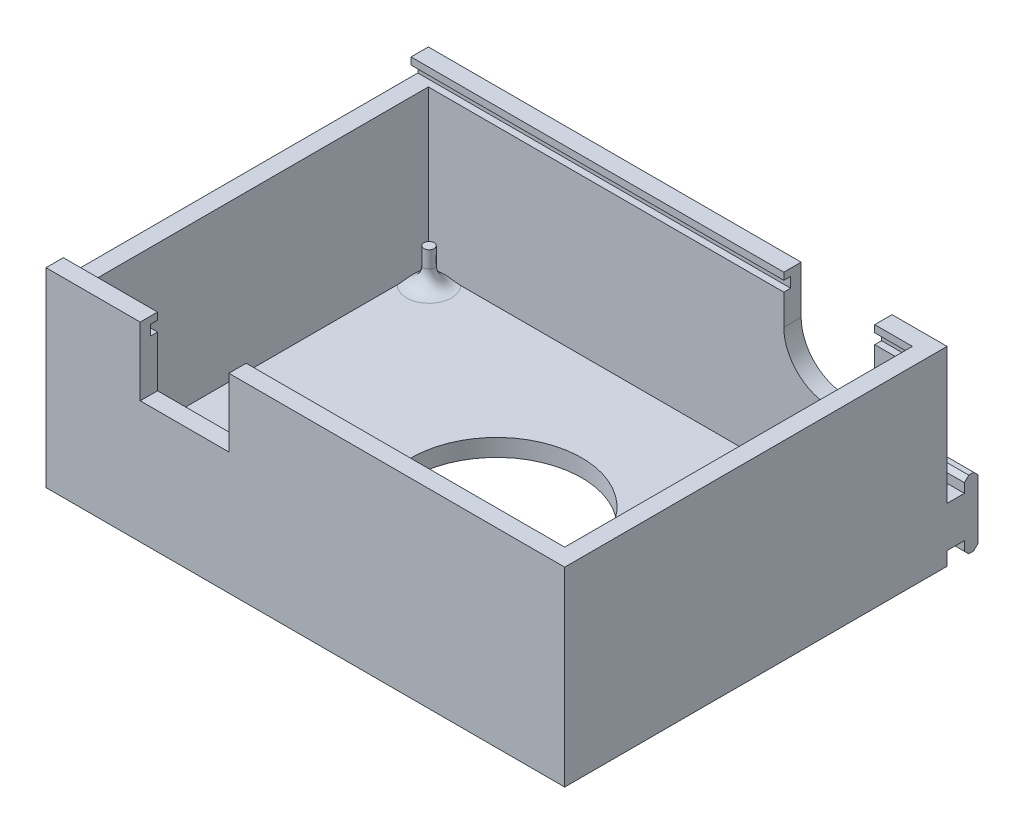
from build123d import *

# Parameters (mm, degrees)
SKETCH1_W           = 76.08
SKETCH1_H           = 56.08
SKETCH1_W_2         = 71
SKETCH1_H_2         = 51
BOSS_EXTRUDE1_DEPTH = 25.4
SKETCH2_W           = 76.08
SKETCH2_H           = 56.08
BOSS_EXTRUDE2_DEPTH = 2.54
CUT_EXTRUDE1_REACH  = 99.869
CUT_EXTRUDE2_REACH  = 99.869
SKETCH5_R           = 0.75
BOSS_EXTRUDE3_DEPTH = 5
FILLET1_R           = 2.54
CUT_EXTRUDE3_REACH  = 99.869
SKETCH6_W           = 13
SKETCH6_H           = 10
BOSS_EXTRUDE4_DEPTH = 76.08
CHAMFER1_SIZE       = 0.635
SKETCH9_R           = 12.5
CUT_EXTRUDE4_DEPTH  = 101.539100877


with BuildPart() as part:
    # Sketch1 → Boss-Extrude1 (new body)
    with BuildSketch(Plane(origin=(0, 0, 0), x_dir=(1, 0, 0), z_dir=(0, 1, 0))):
        with Locations((38.04, 28.04)):
            Rectangle(SKETCH1_W, SKETCH1_H)
        with Locations((38.04, 28.04)):
            Rectangle(SKETCH1_W_2, SKETCH1_H_2, mode=Mode.SUBTRACT)
    extrude(amount=BOSS_EXTRUDE1_DEPTH)

    # Sketch2 → Boss-Extrude2 (add)
    with BuildSketch(Plane.XZ):
        with Locations((38.04, -28.04)):
            Rectangle(SKETCH2_W, SKETCH2_H)
    extrude(amount=BOSS_EXTRUDE2_DEPTH)

    # Sketch3 → Cut-Extrude1 (cut, up to next)
    with BuildSketch(Plane(origin=(0, 0, -56.08), x_dir=(-1, 0, 0), z_dir=(0, 0, -1)), mode=Mode.PRIVATE) as cut_extrude1_sk1:
        with BuildLine():
            Line((-68.0155, 18.400004), (-68.0155, 25.4))
            Line((-68.0155, 25.4), (-54.6805, 25.4))
            Line((-54.6805, 25.4), (-54.6805, 18.400004))
            ThreePointArc((-54.6805, 18.400004), (-61.348, 11.732504), (-68.0155, 18.400004))
        make_face()
    cut_extrude1_tool1 = extrude(cut_extrude1_sk1.sketch, amount=-CUT_EXTRUDE1_REACH, mode=Mode.PRIVATE) & part.part
    add(cut_extrude1_tool1.solids().sort_by_distance((61.348, 19.19119, -56.08))[0], mode=Mode.SUBTRACT)

    # Cut-Extrude2: up to this face of the body (flat: up to its plane)
    cut_extrude2_end = Plane(part.part.faces().sort_by_distance((73.54, 12.7, -28.04))[0])
    # Sketch4 → Cut-Extrude2 (cut, up to the picked face)
    with BuildSketch(Plane.ZY, mode=Mode.PRIVATE) as cut_extrude2_sk1:
        Polygon((-53.54, 25.4), (-53.54, 24.359997), (-54.54, 24.359997), (-54.54, 22.86), (-1.54, 22.86), (-1.54, 24.359997), (-2.54, 24.359997), (-2.54, 25.4), align=None)
    cut_extrude2_tool1 = split(extrude(cut_extrude2_sk1.sketch, amount=-CUT_EXTRUDE2_REACH, mode=Mode.PRIVATE), bisect_by=cut_extrude2_end, keep=Keep.BOTH, mode=Mode.PRIVATE)
    add(cut_extrude2_tool1.solids().sort_by(Axis((0, 24.11823, -28.04), (1, 0, 0)))[0], mode=Mode.SUBTRACT)

    # Sketch5 → Boss-Extrude3 (add)
    with BuildSketch(Plane(origin=(0, 0, 0), x_dir=(1, 0, 0), z_dir=(0, 1, 0))):
        with Locations(Location((4.893, 51.28999999, 0), (0, 0, 90))):
            Circle(SKETCH5_R)
        with Locations(Location((4.893, 4.79000001, 0), (0, 0, 90))):
            Circle(SKETCH5_R)
        with Locations(Location((71.187, 4.79000001, 0), (0, 0, 90))):
            Circle(SKETCH5_R)
        with Locations(Location((71.187, 51.28999999, 0), (0, 0, 90))):
            Circle(SKETCH5_R)
    extrude(amount=BOSS_EXTRUDE3_DEPTH)

    # Fillet1
    # the kernel refuses this fillet: 2.54 mm, written as the material it adds along each edge
    with BuildSketch(Plane(origin=(4.893, 0, -51.28999999), x_dir=(0, 0, -1), z_dir=(1, 0, 0))) as fillet1_piece_1:
        with BuildLine():
            CenterArc((0.75 + FILLET1_R, FILLET1_R), FILLET1_R, 180, 90)
            Line((0.75, FILLET1_R), (0.75, 0))
            Line((0.75, 0), (0.75 + FILLET1_R, 0))
        make_face()
    revolve(axis=Axis((4.893, 0, -51.28999999), (0, 1, 0)))
    with BuildSketch(Plane(origin=(4.893, 0, -4.79000001), x_dir=(0, 0, -1), z_dir=(1, 0, 0))) as fillet1_piece_2:
        with BuildLine():
            CenterArc((0.75 + FILLET1_R, FILLET1_R), FILLET1_R, 180, 90)
            Line((0.75, FILLET1_R), (0.75, 0))
            Line((0.75, 0), (0.75 + FILLET1_R, 0))
        make_face()
    revolve(axis=Axis((4.893, 0, -4.79000001), (0, 1, 0)))
    with BuildSketch(Plane(origin=(71.187, 0, -4.79000001), x_dir=(0, 0, -1), z_dir=(1, 0, 0))) as fillet1_piece_3:
        with BuildLine():
            CenterArc((0.75 + FILLET1_R, FILLET1_R), FILLET1_R, 180, 90)
            Line((0.75, FILLET1_R), (0.75, 0))
            Line((0.75, 0), (0.75 + FILLET1_R, 0))
        make_face()
    revolve(axis=Axis((71.187, 0, -4.79000001), (0, 1, 0)))
    with BuildSketch(Plane(origin=(71.187, 0, -51.28999999), x_dir=(0, 0, -1), z_dir=(1, 0, 0))) as fillet1_piece_4:
        with BuildLine():
            CenterArc((0.75 + FILLET1_R, FILLET1_R), FILLET1_R, 180, 90)
            Line((0.75, FILLET1_R), (0.75, 0))
            Line((0.75, 0), (0.75 + FILLET1_R, 0))
        make_face()
    revolve(axis=Axis((71.187, 0, -51.28999999), (0, 1, 0)))

    # Sketch6 → Cut-Extrude3 (cut, up to next)
    with BuildSketch(Plane.XY, mode=Mode.PRIVATE) as cut_extrude3_sk1:
        with Locations((20.32, 20.4)):
            Rectangle(SKETCH6_W, SKETCH6_H)
    cut_extrude3_tool1 = extrude(cut_extrude3_sk1.sketch, amount=-CUT_EXTRUDE3_REACH, mode=Mode.PRIVATE) & part.part
    add(cut_extrude3_tool1.solids().sort_by_distance((20.32, 20.4, 0))[0], mode=Mode.SUBTRACT)

    # Sketch7 → Boss-Extrude4 (add)
    with BuildSketch(Plane.ZY):
        Polygon((-56.08, -0.54), (-58.62, -0.54), (-58.62, -2.54), (-60.62, -2.54), (-60.62, 7.46), (-58.62, 7.46), (-58.62, 5.46), (-56.08, 5.46), align=None)
    extrude(amount=-BOSS_EXTRUDE4_DEPTH)

    # Chamfer1
    chamfer1_edges = [part.edges().sort_by_distance(p)[0] for p in [
        (38.04, -2.54, -58.62),
        (38.04, -2.54, -60.62),
        (38.04, 7.46, -60.62),
        (38.04, 7.46, -58.62),
    ]]
    chamfer(chamfer1_edges, length=CHAMFER1_SIZE)

    # Sketch9 → Cut-Extrude4 (cut, through all)
    with BuildSketch(Plane(origin=(0, 0, 0), x_dir=(1, 0, 0), z_dir=(0, 1, 0))):
        with Locations(Location((38.04, 28.04, 0), (0, 0, 270))):
            Circle(SKETCH9_R)
    extrude(amount=-CUT_EXTRUDE4_DEPTH, mode=Mode.SUBTRACT)


solid = part.part
